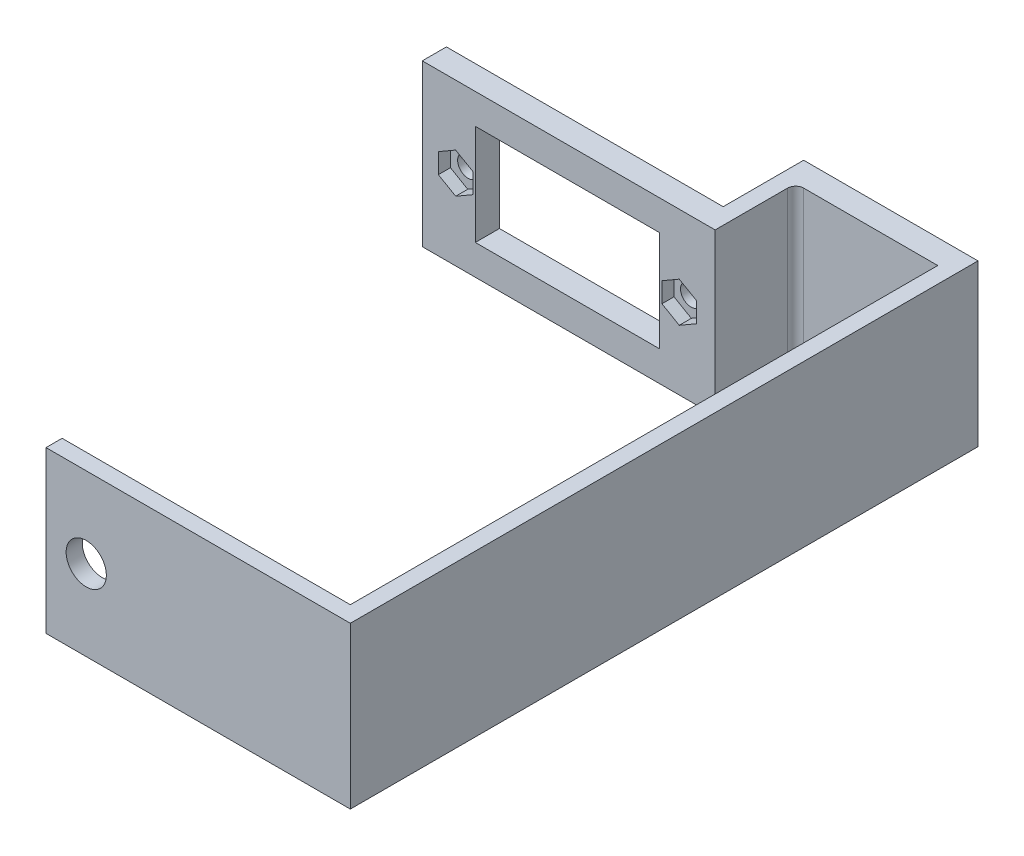
from build123d import *

# Parameters (mm, degrees)
BOSS_EXTRUDE1_START       = 26.09
SKETCH2_W                 = 20
SKETCH2_H                 = 73
BOSS_EXTRUDE1_DEPTH       = 2
SKETCH3_W                 = 37.815629263
SKETCH3_H                 = 20
SKETCH3_R                 = 2.5
BOSS_EXTRUDE2_DEPTH       = 2
BOSS_EXTRUDE3_START       = -3
BOSS_EXTRUDE3_OUTLINE_W   = 34.391343997
BOSS_EXTRUDE3_OUTLINE_H   = 20
BOSS_EXTRUDE3_OUTLINE_R   = 1.1
BOSS_EXTRUDE3_OUTLINE_W_2 = 22.89999
BOSS_EXTRUDE3_OUTLINE_H_2 = 12.5
BOSS_EXTRUDE3_DEPTH       = 3
SKETCH7_W                 = 10
SKETCH7_H                 = 20
BOSS_EXTRUDE4_DEPTH       = 2
SKETCH8_W                 = 21.665624263
SKETCH8_H                 = 20
BOSS_EXTRUDE5_DEPTH       = 3
FILLET1_R                 = 1
CUT_EXTRUDE5_START        = -3
SKETCH4_3_R               = 1.1
CUT_EXTRUDE5_DEPTH        = 1.5
M2_CLEARANCE_HOLE1_D      = 2.6
M2_CLEARANCE_HOLE1_DEPTH  = 3
M2_CLEARANCE_HOLE1_TIP    = 0.781118805


# Read off the part's stored shape, not the designer's step: Boss-Extrude3
with BuildPart() as part:
    # Sketch2 → Boss-Extrude1 (new body)
    with BuildSketch(Plane(origin=(0, 0, 13.2), x_dir=(0, 1, 0), z_dir=(1, 0, 0)).offset(BOSS_EXTRUDE1_START)):
        with Locations((-24.849481376, -4.332139258)):
            Rectangle(SKETCH2_W, SKETCH2_H)
    extrude(amount=BOSS_EXTRUDE1_DEPTH)

    # Sketch3 → Boss-Extrude2 (add)
    with BuildSketch(Plane.XY.offset(45.367860742)):
        with Locations((9.182185369, -24.849481376)):
            Rectangle(SKETCH3_W, SKETCH3_H)
        with Locations((-4.725629263, -24.849481376)):
            Circle(SKETCH3_R, mode=Mode.SUBTRACT)
    extrude(amount=BOSS_EXTRUDE2_DEPTH)



with BuildPart() as body_2:
    # Boss-Extrude3 outline → Boss-Extrude3 (new body)
    with BuildSketch(Plane(origin=(0, 0, -20.632139258), x_dir=(-1, 0, 0), z_dir=(0, 0, -1)).offset(BOSS_EXTRUDE3_START)):
        with Locations((10.771296262, -24.849481376)):
            Rectangle(BOSS_EXTRUDE3_OUTLINE_W, BOSS_EXTRUDE3_OUTLINE_H)
        with Locations((-3.924375737, -24.849481376)):
            Circle(BOSS_EXTRUDE3_OUTLINE_R, mode=Mode.SUBTRACT)
        with Locations((9.925624263, -24.849481376)):
            Rectangle(BOSS_EXTRUDE3_OUTLINE_W_2, BOSS_EXTRUDE3_OUTLINE_H_2, mode=Mode.SUBTRACT)
        with Locations((23.775624263, -24.849481376)):
            Circle(BOSS_EXTRUDE3_OUTLINE_R, mode=Mode.SUBTRACT)
    extrude(amount=BOSS_EXTRUDE3_DEPTH)

    # Sketch7 → Boss-Extrude4 (add)
    with BuildSketch(Plane(origin=(6.424375737, 0, 0), x_dir=(0, 0, -1), z_dir=(1, 0, 0))):
        with Locations((22.632139258, -24.849481376)):
            Rectangle(SKETCH7_W, SKETCH7_H)
    extrude(amount=BOSS_EXTRUDE4_DEPTH)


with BuildPart() as part_1:
    add(part.part)

    add(body_2.part)  # Boss-Extrude5 merges body 2
    # Sketch8 → Boss-Extrude5 (add)
    with BuildSketch(Plane(origin=(0, 0, -27.632139258), x_dir=(-1, 0, 0), z_dir=(0, 0, -1))):
        with Locations((-17.257187869, -24.849481376)):
            Rectangle(SKETCH8_W, SKETCH8_H)
    extrude(amount=BOSS_EXTRUDE5_DEPTH)

    # Fillet1
    fillet1_edges = [part_1.edges().sort_by_distance(p)[0] for p in [
        (8.424375737, -24.849481376, -27.632139258),
    ]]
    fillet(fillet1_edges, radius=FILLET1_R)

    # Sketch4<3> → Cut-Extrude5 (cut)
    # profile 1 of 4: a face of its own
    with BuildSketch(Plane(origin=(0, 0, -20.632139258), x_dir=(-1, 0, 0), z_dir=(0, 0, -1)).offset(CUT_EXTRUDE5_START)):
        Polygon((-3.965719734, -22.379328504), (-1.815719734, -23.620631583), (-1.815719734, -26.103237741), (-3.965719734, -27.344540819), (-6.115719734, -26.103237741), (-6.115719734, -23.620631583), align=None)
        with Locations((-3.924375737, -24.849481376)):
            Circle(SKETCH4_3_R, mode=Mode.SUBTRACT)
    # profile 2 of 4: a face of its own
    with BuildSketch(Plane(origin=(0, 0, -20.632139258), x_dir=(-1, 0, 0), z_dir=(0, 0, -1)).offset(CUT_EXTRUDE5_START)):
        Polygon((23.81696826, -22.379328504), (21.66696826, -23.620631583), (21.66696826, -26.103237741), (23.81696826, -27.344540819), (25.96696826, -26.103237741), (25.96696826, -23.620631583), align=None)
        with Locations(Location((23.775624263, -24.849481376, 0), (0, 0, 180))):
            Circle(SKETCH4_3_R, mode=Mode.SUBTRACT)
    # profile 3 of 4: a face of its own
    with BuildSketch(Plane(origin=(0, 0, -20.632139258), x_dir=(-1, 0, 0), z_dir=(0, 0, -1)).offset(CUT_EXTRUDE5_START)):
        with Locations((-3.924375737, -24.849481376)):
            Circle(SKETCH4_3_R)
    # profile 4 of 4: a face of its own
    with BuildSketch(Plane(origin=(0, 0, -20.632139258), x_dir=(-1, 0, 0), z_dir=(0, 0, -1)).offset(CUT_EXTRUDE5_START)):
        with Locations(Location((23.775624263, -24.849481376, 0), (0, 0, 180))):
            Circle(SKETCH4_3_R)
    extrude(amount=CUT_EXTRUDE5_DEPTH, mode=Mode.SUBTRACT)

    # M2 Clearance Hole1
    with Locations(Plane(origin=(0, 0, -20.632139258), x_dir=(-1, 0, 0), z_dir=(0, 0, -1))):
        with Locations((-3.924375737, -24.849481376), (23.775624263, -24.849481376)):
            Hole(M2_CLEARANCE_HOLE1_D / 2, depth=M2_CLEARANCE_HOLE1_DEPTH)
            with Locations((0, 0, -(M2_CLEARANCE_HOLE1_DEPTH + M2_CLEARANCE_HOLE1_TIP / 2))):  # 118° drill point
                Cone(0, M2_CLEARANCE_HOLE1_D / 2, M2_CLEARANCE_HOLE1_TIP, mode=Mode.SUBTRACT)


solid = part_1.part
